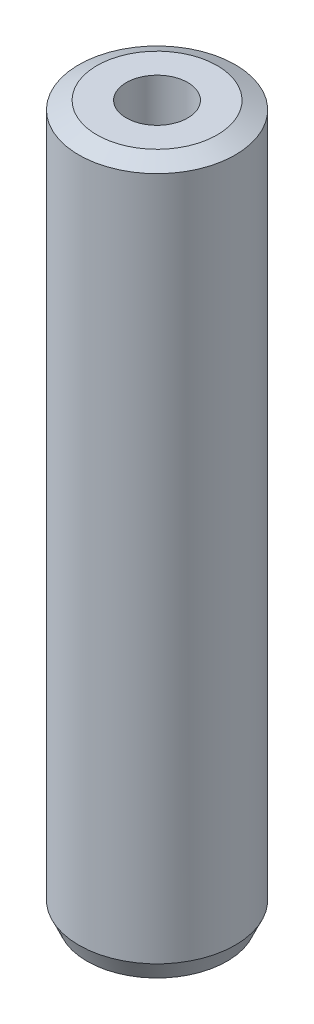
from build123d import *
from OCP.BRepFilletAPI import BRepFilletAPI_MakeChamfer

# Parameters (mm, degrees)
SKETCH1_R           = 35
BOSS_EXTRUDE1_DEPTH = 317.944374813
SKETCH2_R           = 13.750110779
CUT_EXTRUDE1_DEPTH  = 322.774183979
CHAMFER1_SIZE       = 3.709451367
CHAMFER1_SIZE2      = 8.110500782


with BuildPart() as part:
    # Sketch1 → Boss-Extrude1 (new body)
    with BuildSketch(Plane(origin=(0, 0, 0), x_dir=(1, 0, 0), z_dir=(0, 1, 0))):
        Circle(SKETCH1_R)
    extrude(amount=BOSS_EXTRUDE1_DEPTH)

    # Sketch2 → Cut-Extrude1 (cut, through all)
    with BuildSketch(Plane(origin=(0, 0, 0), x_dir=(1, 0, 0), z_dir=(0, 1, 0))):
        Circle(SKETCH2_R)
    extrude(amount=CUT_EXTRUDE1_DEPTH, mode=Mode.SUBTRACT)

    # Chamfer1: one chamfer whose edges measure the first distance from different faces: ONE call of the kernel's chamfer builder (chamfer() names one face for all edges)
    chamfer1_edges_1 = [part.edges().sort_by_distance(p)[0] for p in [
        (-35, 317.944374813, 0),
    ]]
    chamfer1_side_1 = [part.faces().sort_by_distance(p)[0] for p in [
        (-35, 158.972187406, 0),
    ]]
    chamfer1_edges_2 = [part.edges().sort_by_distance(p)[0] for p in [
        (-35, 0, 0),
    ]]
    chamfer1_side_2 = [part.faces().sort_by_distance(p)[0] for p in [
        (-34.010050506, 0, 0),
    ]]
    chamfer1 = BRepFilletAPI_MakeChamfer(part.part.solid().wrapped)
    for e in chamfer1_edges_1:
        chamfer1.Add(CHAMFER1_SIZE, CHAMFER1_SIZE2, e.wrapped, chamfer1_side_1[0].wrapped)  # the first distance lies on this face
    for e in chamfer1_edges_2:
        chamfer1.Add(CHAMFER1_SIZE, CHAMFER1_SIZE2, e.wrapped, chamfer1_side_2[0].wrapped)  # the first distance lies on this face
    add(Compound.cast(chamfer1.Shape()), mode=Mode.REPLACE)


solid = part.part
